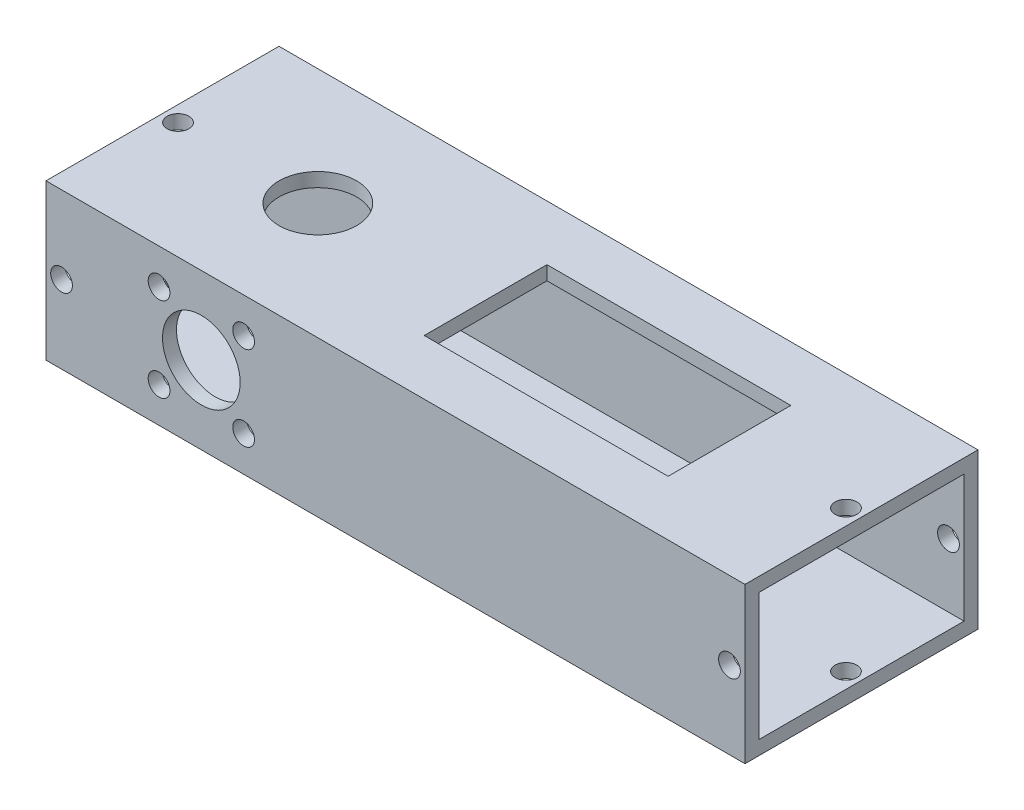
from build123d import *

# Parameters (mm, degrees)
SKETCH1_W           = 114.3
SKETCH1_H           = 38.1
BOSS_EXTRUDE1_DEPTH = 25.4
CUT_EXTRUDE1_REACH  = 125.131
SKETCH2_W           = 33.528
SKETCH2_H           = 20.828
CUT_EXTRUDE2_REACH  = 125.131
SKETCH3_R           = 1.778
CUT_EXTRUDE3_REACH  = 125.131
SKETCH4_R           = 1.778
CUT_EXTRUDE4_REACH  = 125.131
SKETCH5_R           = 1.778
SKETCH5_R_2         = 6.35
CUT_EXTRUDE5_REACH  = 125.131
SKETCH6_R           = 1.778
SKETCH6_R_2         = 6.35
CUT_EXTRUDE6_REACH  = 125.131
SKETCH7_R           = 1.778
SKETCH7_R_2         = 6.35
CUT_EXTRUDE7_REACH  = 125.131
SKETCH8_R           = 1.778
SKETCH8_R_2         = 6.35
CUT_EXTRUDE8_REACH  = 125.131
SKETCH9_R           = 1.778
CUT_EXTRUDE9_REACH  = 125.131
SKETCH10_R          = 1.778


with BuildPart() as part:
    # Sketch1 → Boss-Extrude1 (new body)
    with BuildSketch(Plane(origin=(0, 0, 0), x_dir=(1, 0, 0), z_dir=(0, 1, 0))):
        with Locations((-57.15, -19.05)):
            Rectangle(SKETCH1_W, SKETCH1_H)
    extrude(amount=BOSS_EXTRUDE1_DEPTH)

    # Sketch2 → Cut-Extrude1 (cut, up to next)
    with BuildSketch(Plane(origin=(0, 0, 0), x_dir=(0, 0, -1), z_dir=(1, 0, 0)), mode=Mode.PRIVATE) as cut_extrude1_sk1:
        with Locations((-19.05, 12.7)):
            Rectangle(SKETCH2_W, SKETCH2_H)
    cut_extrude1_tool1 = extrude(cut_extrude1_sk1.sketch, amount=-CUT_EXTRUDE1_REACH, mode=Mode.PRIVATE) & part.part
    add(cut_extrude1_tool1.solids().sort_by_distance((0, 12.7, 19.05))[0], mode=Mode.SUBTRACT)

    # Sketch3 → Cut-Extrude2 (cut, up to next)
    with BuildSketch(Plane.XY.offset(38.1), mode=Mode.PRIVATE) as cut_extrude2_sk1:
        with Locations((-2.54, 12.7)):
            Circle(SKETCH3_R)
    cut_extrude2_tool1 = extrude(cut_extrude2_sk1.sketch, amount=-CUT_EXTRUDE2_REACH, mode=Mode.PRIVATE) & part.part
    add(cut_extrude2_tool1.solids().sort_by_distance((-2.54, 12.7, 38.1))[0], mode=Mode.SUBTRACT)

    # Sketch4 → Cut-Extrude3 (cut, up to next)
    with BuildSketch(Plane(origin=(0, 0, 0), x_dir=(-1, 0, 0), z_dir=(0, 0, -1)), mode=Mode.PRIVATE) as cut_extrude3_sk1:
        with Locations((2.54, 12.7)):
            Circle(SKETCH4_R)
    cut_extrude3_tool1 = extrude(cut_extrude3_sk1.sketch, amount=-CUT_EXTRUDE3_REACH, mode=Mode.PRIVATE) & part.part
    add(cut_extrude3_tool1.solids().sort_by_distance((-2.54, 12.7, 0))[0], mode=Mode.SUBTRACT)

    # Sketch5 → Cut-Extrude4 (cut, up to next)
    with BuildSketch(Plane.XY.offset(38.1), mode=Mode.PRIVATE) as cut_extrude4_sk1:
        with Locations((-111.76, 12.7)):
            Circle(SKETCH5_R)
    cut_extrude4_tool1 = extrude(cut_extrude4_sk1.sketch, amount=-CUT_EXTRUDE4_REACH, mode=Mode.PRIVATE) & part.part
    # Sketch5 → Cut-Extrude4 (cut, up to next)
    with BuildSketch(Plane.XY.offset(38.1), mode=Mode.PRIVATE) as cut_extrude4_sk2:
        with Locations((-88.9, 12.7)):
            Circle(SKETCH5_R_2)
    cut_extrude4_tool2 = extrude(cut_extrude4_sk2.sketch, amount=-CUT_EXTRUDE4_REACH, mode=Mode.PRIVATE) & part.part
    # Sketch5 → Cut-Extrude4 (cut, up to next)
    with BuildSketch(Plane.XY.offset(38.1), mode=Mode.PRIVATE) as cut_extrude4_sk3:
        with Locations((-95.814797213, 19.614797213)):
            Circle(SKETCH5_R)
    cut_extrude4_tool3 = extrude(cut_extrude4_sk3.sketch, amount=-CUT_EXTRUDE4_REACH, mode=Mode.PRIVATE) & part.part
    # Sketch5 → Cut-Extrude4 (cut, up to next)
    with BuildSketch(Plane.XY.offset(38.1), mode=Mode.PRIVATE) as cut_extrude4_sk4:
        with Locations((-81.985202787, 19.614797213)):
            Circle(SKETCH5_R)
    cut_extrude4_tool4 = extrude(cut_extrude4_sk4.sketch, amount=-CUT_EXTRUDE4_REACH, mode=Mode.PRIVATE) & part.part
    # Sketch5 → Cut-Extrude4 (cut, up to next)
    with BuildSketch(Plane.XY.offset(38.1), mode=Mode.PRIVATE) as cut_extrude4_sk5:
        with Locations((-95.814797213, 5.785202787)):
            Circle(SKETCH5_R)
    cut_extrude4_tool5 = extrude(cut_extrude4_sk5.sketch, amount=-CUT_EXTRUDE4_REACH, mode=Mode.PRIVATE) & part.part
    # Sketch5 → Cut-Extrude4 (cut, up to next)
    with BuildSketch(Plane.XY.offset(38.1), mode=Mode.PRIVATE) as cut_extrude4_sk6:
        with Locations((-81.985202787, 5.785202787)):
            Circle(SKETCH5_R)
    cut_extrude4_tool6 = extrude(cut_extrude4_sk6.sketch, amount=-CUT_EXTRUDE4_REACH, mode=Mode.PRIVATE) & part.part
    add(cut_extrude4_tool1.solids().sort_by_distance((-111.76, 12.7, 38.1))[0], mode=Mode.SUBTRACT)
    add(cut_extrude4_tool2.solids().sort_by_distance((-88.9, 12.7, 38.1))[0], mode=Mode.SUBTRACT)
    add(cut_extrude4_tool3.solids().sort_by_distance((-95.814797, 19.614797, 38.1))[0], mode=Mode.SUBTRACT)
    add(cut_extrude4_tool4.solids().sort_by_distance((-81.985203, 19.614797, 38.1))[0], mode=Mode.SUBTRACT)
    add(cut_extrude4_tool5.solids().sort_by_distance((-95.814797, 5.785203, 38.1))[0], mode=Mode.SUBTRACT)
    add(cut_extrude4_tool6.solids().sort_by_distance((-81.985203, 5.785203, 38.1))[0], mode=Mode.SUBTRACT)

    # Sketch6 → Cut-Extrude5 (cut, up to next)
    with BuildSketch(Plane(origin=(0, 0, 0), x_dir=(-1, 0, 0), z_dir=(0, 0, -1)), mode=Mode.PRIVATE) as cut_extrude5_sk1:
        with Locations((111.76, 12.7)):
            Circle(SKETCH6_R)
    cut_extrude5_tool1 = extrude(cut_extrude5_sk1.sketch, amount=-CUT_EXTRUDE5_REACH, mode=Mode.PRIVATE) & part.part
    # Sketch6 → Cut-Extrude5 (cut, up to next)
    with BuildSketch(Plane(origin=(0, 0, 0), x_dir=(-1, 0, 0), z_dir=(0, 0, -1)), mode=Mode.PRIVATE) as cut_extrude5_sk2:
        with Locations((88.9, 12.7)):
            Circle(SKETCH6_R_2)
    cut_extrude5_tool2 = extrude(cut_extrude5_sk2.sketch, amount=-CUT_EXTRUDE5_REACH, mode=Mode.PRIVATE) & part.part
    # Sketch6 → Cut-Extrude5 (cut, up to next)
    with BuildSketch(Plane(origin=(0, 0, 0), x_dir=(-1, 0, 0), z_dir=(0, 0, -1)), mode=Mode.PRIVATE) as cut_extrude5_sk3:
        with Locations((81.985202787, 19.614797213)):
            Circle(SKETCH6_R)
    cut_extrude5_tool3 = extrude(cut_extrude5_sk3.sketch, amount=-CUT_EXTRUDE5_REACH, mode=Mode.PRIVATE) & part.part
    # Sketch6 → Cut-Extrude5 (cut, up to next)
    with BuildSketch(Plane(origin=(0, 0, 0), x_dir=(-1, 0, 0), z_dir=(0, 0, -1)), mode=Mode.PRIVATE) as cut_extrude5_sk4:
        with Locations((95.814797213, 19.614797213)):
            Circle(SKETCH6_R)
    cut_extrude5_tool4 = extrude(cut_extrude5_sk4.sketch, amount=-CUT_EXTRUDE5_REACH, mode=Mode.PRIVATE) & part.part
    # Sketch6 → Cut-Extrude5 (cut, up to next)
    with BuildSketch(Plane(origin=(0, 0, 0), x_dir=(-1, 0, 0), z_dir=(0, 0, -1)), mode=Mode.PRIVATE) as cut_extrude5_sk5:
        with Locations((95.814797213, 5.785202787)):
            Circle(SKETCH6_R)
    cut_extrude5_tool5 = extrude(cut_extrude5_sk5.sketch, amount=-CUT_EXTRUDE5_REACH, mode=Mode.PRIVATE) & part.part
    # Sketch6 → Cut-Extrude5 (cut, up to next)
    with BuildSketch(Plane(origin=(0, 0, 0), x_dir=(-1, 0, 0), z_dir=(0, 0, -1)), mode=Mode.PRIVATE) as cut_extrude5_sk6:
        with Locations((81.985202787, 5.785202787)):
            Circle(SKETCH6_R)
    cut_extrude5_tool6 = extrude(cut_extrude5_sk6.sketch, amount=-CUT_EXTRUDE5_REACH, mode=Mode.PRIVATE) & part.part
    add(cut_extrude5_tool1.solids().sort_by_distance((-111.76, 12.7, 0))[0], mode=Mode.SUBTRACT)
    add(cut_extrude5_tool2.solids().sort_by_distance((-88.9, 12.7, 0))[0], mode=Mode.SUBTRACT)
    add(cut_extrude5_tool3.solids().sort_by_distance((-81.985203, 19.614797, 0))[0], mode=Mode.SUBTRACT)
    add(cut_extrude5_tool4.solids().sort_by_distance((-95.814797, 19.614797, 0))[0], mode=Mode.SUBTRACT)
    add(cut_extrude5_tool5.solids().sort_by_distance((-95.814797, 5.785203, 0))[0], mode=Mode.SUBTRACT)
    add(cut_extrude5_tool6.solids().sort_by_distance((-81.985203, 5.785203, 0))[0], mode=Mode.SUBTRACT)

    # Sketch7 → Cut-Extrude6 (cut, up to next)
    with BuildSketch(Plane(origin=(0, 25.4, 0), x_dir=(1, 0, 0), z_dir=(0, 1, 0)), mode=Mode.PRIVATE) as cut_extrude6_sk1:
        with Locations((-111.76, -19.05)):
            Circle(SKETCH7_R)
    cut_extrude6_tool1 = extrude(cut_extrude6_sk1.sketch, amount=-CUT_EXTRUDE6_REACH, mode=Mode.PRIVATE) & part.part
    # Sketch7 → Cut-Extrude6 (cut, up to next)
    with BuildSketch(Plane(origin=(0, 25.4, 0), x_dir=(1, 0, 0), z_dir=(0, 1, 0)), mode=Mode.PRIVATE) as cut_extrude6_sk2:
        with Locations((-88.9, -19.05)):
            Circle(SKETCH7_R_2)
    cut_extrude6_tool2 = extrude(cut_extrude6_sk2.sketch, amount=-CUT_EXTRUDE6_REACH, mode=Mode.PRIVATE) & part.part
    # Sketch7 → Cut-Extrude6 (cut, up to next)
    with BuildSketch(Plane(origin=(0, 25.4, 0), x_dir=(1, 0, 0), z_dir=(0, 1, 0)), mode=Mode.PRIVATE) as cut_extrude6_sk3:
        Polygon((-61.468, -19.05), (-61.468, -9.017), (-21.59, -9.017), (-21.59, -29.083), (-61.468, -29.083), align=None)
    cut_extrude6_tool3 = extrude(cut_extrude6_sk3.sketch, amount=-CUT_EXTRUDE6_REACH, mode=Mode.PRIVATE) & part.part
    add(cut_extrude6_tool1.solids().sort_by_distance((-111.76, 25.4, 19.05))[0], mode=Mode.SUBTRACT)
    add(cut_extrude6_tool2.solids().sort_by_distance((-88.9, 25.4, 19.05))[0], mode=Mode.SUBTRACT)
    add(cut_extrude6_tool3.solids().sort_by_distance((-41.529, 25.4, 19.05))[0], mode=Mode.SUBTRACT)

    # Sketch8 → Cut-Extrude7 (cut, up to next)
    with BuildSketch(Plane.XZ, mode=Mode.PRIVATE) as cut_extrude7_sk1:
        with Locations((-111.76, 19.05)):
            Circle(SKETCH8_R)
    cut_extrude7_tool1 = extrude(cut_extrude7_sk1.sketch, amount=-CUT_EXTRUDE7_REACH, mode=Mode.PRIVATE) & part.part
    # Sketch8 → Cut-Extrude7 (cut, up to next)
    with BuildSketch(Plane.XZ, mode=Mode.PRIVATE) as cut_extrude7_sk2:
        with Locations((-88.9, 19.05)):
            Circle(SKETCH8_R_2)
    cut_extrude7_tool2 = extrude(cut_extrude7_sk2.sketch, amount=-CUT_EXTRUDE7_REACH, mode=Mode.PRIVATE) & part.part
    # Sketch8 → Cut-Extrude7 (cut, up to next)
    with BuildSketch(Plane.XZ, mode=Mode.PRIVATE) as cut_extrude7_sk3:
        Polygon((-61.468, 19.05), (-61.468, 29.083), (-21.59, 29.083), (-21.59, 9.017), (-61.468, 9.017), align=None)
    cut_extrude7_tool3 = extrude(cut_extrude7_sk3.sketch, amount=-CUT_EXTRUDE7_REACH, mode=Mode.PRIVATE) & part.part
    add(cut_extrude7_tool1.solids().sort_by_distance((-111.76, 0, 19.05))[0], mode=Mode.SUBTRACT)
    add(cut_extrude7_tool2.solids().sort_by_distance((-88.9, 0, 19.05))[0], mode=Mode.SUBTRACT)
    add(cut_extrude7_tool3.solids().sort_by_distance((-41.529, 0, 19.05))[0], mode=Mode.SUBTRACT)

    # Sketch9 → Cut-Extrude8 (cut, up to next)
    with BuildSketch(Plane(origin=(0, 25.4, 0), x_dir=(1, 0, 0), z_dir=(0, 1, 0)), mode=Mode.PRIVATE) as cut_extrude8_sk1:
        with Locations((-2.54, -19.05)):
            Circle(SKETCH9_R)
    cut_extrude8_tool1 = extrude(cut_extrude8_sk1.sketch, amount=-CUT_EXTRUDE8_REACH, mode=Mode.PRIVATE) & part.part
    add(cut_extrude8_tool1.solids().sort_by_distance((-2.54, 25.4, 19.05))[0], mode=Mode.SUBTRACT)

    # Sketch10 → Cut-Extrude9 (cut, up to next)
    with BuildSketch(Plane(origin=(0, 0, 0), x_dir=(-1, 0, 0), z_dir=(0, -1, 0)), mode=Mode.PRIVATE) as cut_extrude9_sk1:
        with Locations((2.54, -19.05)):
            Circle(SKETCH10_R)
    cut_extrude9_tool1 = extrude(cut_extrude9_sk1.sketch, amount=-CUT_EXTRUDE9_REACH, mode=Mode.PRIVATE) & part.part
    add(cut_extrude9_tool1.solids().sort_by_distance((-2.54, 0, 19.05))[0], mode=Mode.SUBTRACT)


solid = part.part
